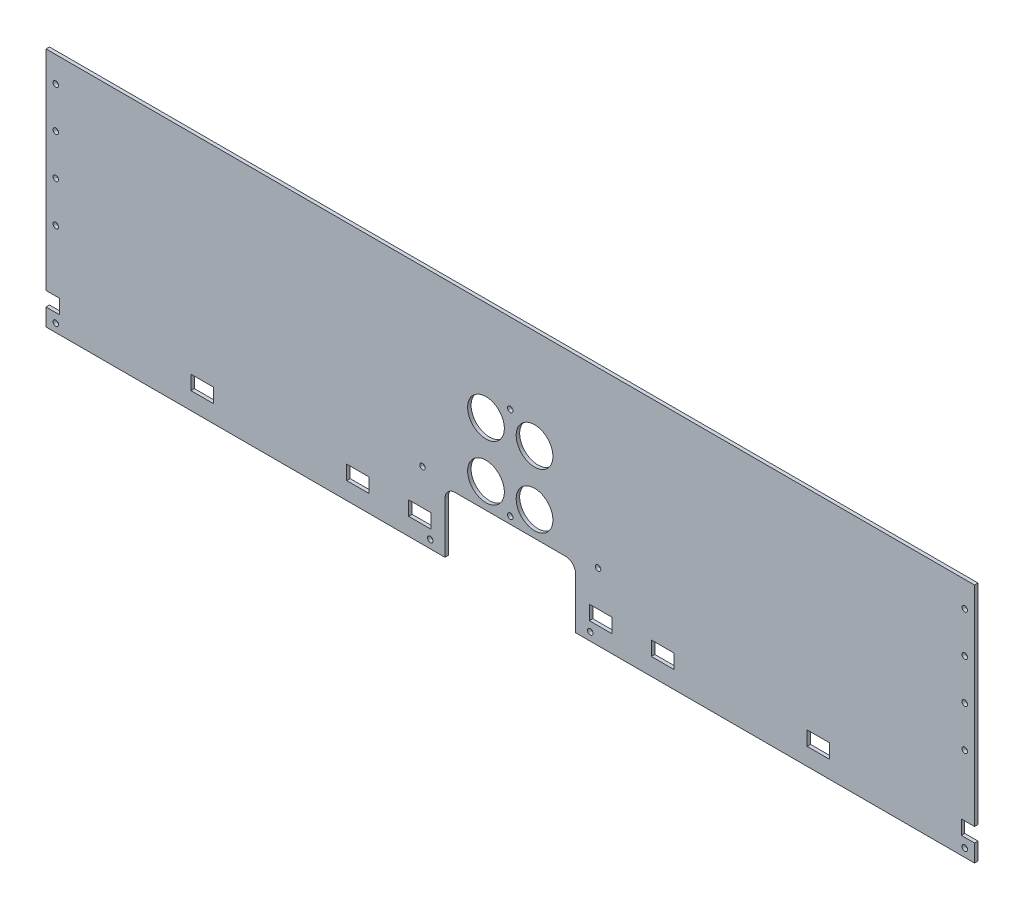
from build123d import *

# Parameters (mm, degrees)
SKETCH3_W           = 455
SKETCH3_H           = 118
BOSS_EXTRUDE2_DEPTH = 1.7
SKETCH4_R           = 1.35
CUT_EXTRUDE1_DEPTH  = 236.032210558
CUT_EXTRUDE2_DEPTH  = 236.032210558
SKETCH6_R           = 9
CUT_EXTRUDE3_DEPTH  = 236.032210558
SKETCH8_W           = 11
SKETCH8_H           = 7
CUT_EXTRUDE4_DEPTH  = 236.032210558


with BuildPart() as part:
    # Sketch3 → Boss-Extrude2 (new body)
    with BuildSketch(Plane.XY):
        Rectangle(SKETCH3_W, SKETCH3_H)
    extrude(amount=BOSS_EXTRUDE2_DEPTH)

    # Sketch4 → Cut-Extrude1 (cut, through all)
    with BuildSketch(Plane.XY.offset(1.7)):
        with Locations((0, 19.8)):
            Circle(SKETCH4_R)
        with Locations((0, -25.5)):
            Circle(SKETCH4_R)
        with Locations((39.2, -55)):
            Circle(SKETCH4_R)
        with Locations((43, -26)):
            Circle(SKETCH4_R)
        with Locations((222.7, -55)):
            Circle(SKETCH4_R)
        with Locations((-222.7, -55)):
            Circle(SKETCH4_R)
        with Locations((-43, -26)):
            Circle(SKETCH4_R)
        with Locations((-39.2, -55)):
            Circle(SKETCH4_R)
        with Locations((222.7, 46.5)):
            Circle(SKETCH4_R)
        with Locations((222.7, 26.5)):
            Circle(SKETCH4_R)
        with Locations((222.7, 6.5)):
            Circle(SKETCH4_R)
        with Locations((222.7, -13.5)):
            Circle(SKETCH4_R)
        with Locations((-222.7, -13.5)):
            Circle(SKETCH4_R)
        with Locations((-222.7, 6.5)):
            Circle(SKETCH4_R)
        with Locations((-222.7, 26.5)):
            Circle(SKETCH4_R)
        with Locations((-222.7, 46.5)):
            Circle(SKETCH4_R)
    extrude(amount=-CUT_EXTRUDE1_DEPTH, mode=Mode.SUBTRACT)

    # Sketch5 → Cut-Extrude2 (cut, through all)
    with BuildSketch(Plane.XY.offset(1.7)):
        with BuildLine():
            Line((-32, -59), (32, -59))
            Line((32, -59), (32, -34))
            ThreePointArc((32, -34), (30.535533906, -30.464466094), (27, -29))
            Line((27, -29), (-27, -29))
            ThreePointArc((-27, -29), (-30.535533906, -30.464466094), (-32, -34))
            Line((-32, -34), (-32, -59))
        make_face()
    extrude(amount=-CUT_EXTRUDE2_DEPTH, mode=Mode.SUBTRACT)

    # Sketch6 → Cut-Extrude3 (cut, through all)
    with BuildSketch(Plane.XY.offset(1.7)):
        with Locations((-11.9, -16.75)):
            Circle(SKETCH6_R)
        with Locations((-11.9, 10.25)):
            Circle(SKETCH6_R)
        with Locations((11.9, -16.75)):
            Circle(SKETCH6_R)
        with Locations((11.9, 10.25)):
            Circle(SKETCH6_R)
    extrude(amount=-CUT_EXTRUDE3_DEPTH, mode=Mode.SUBTRACT)

    # Sketch8 → Cut-Extrude4 (cut, through all)
    with BuildSketch(Plane.XY.offset(1.7)):
        with Locations((-44.26, -47)):
            Rectangle(SKETCH8_W, SKETCH8_H)
        with Locations((-74.63, -47)):
            Rectangle(SKETCH8_W, SKETCH8_H)
        with Locations((-151, -47)):
            Rectangle(SKETCH8_W, SKETCH8_H)
        with Locations((-226.5, -47)):
            Rectangle(SKETCH8_W, SKETCH8_H)
        with Locations((226.5, -47)):
            Rectangle(SKETCH8_W, SKETCH8_H)
        with Locations((151, -47)):
            Rectangle(SKETCH8_W, SKETCH8_H)
        with Locations((74.63, -47)):
            Rectangle(SKETCH8_W, SKETCH8_H)
        with Locations((44.26, -47)):
            Rectangle(SKETCH8_W, SKETCH8_H)
    extrude(amount=-CUT_EXTRUDE4_DEPTH, mode=Mode.SUBTRACT)


solid = part.part
